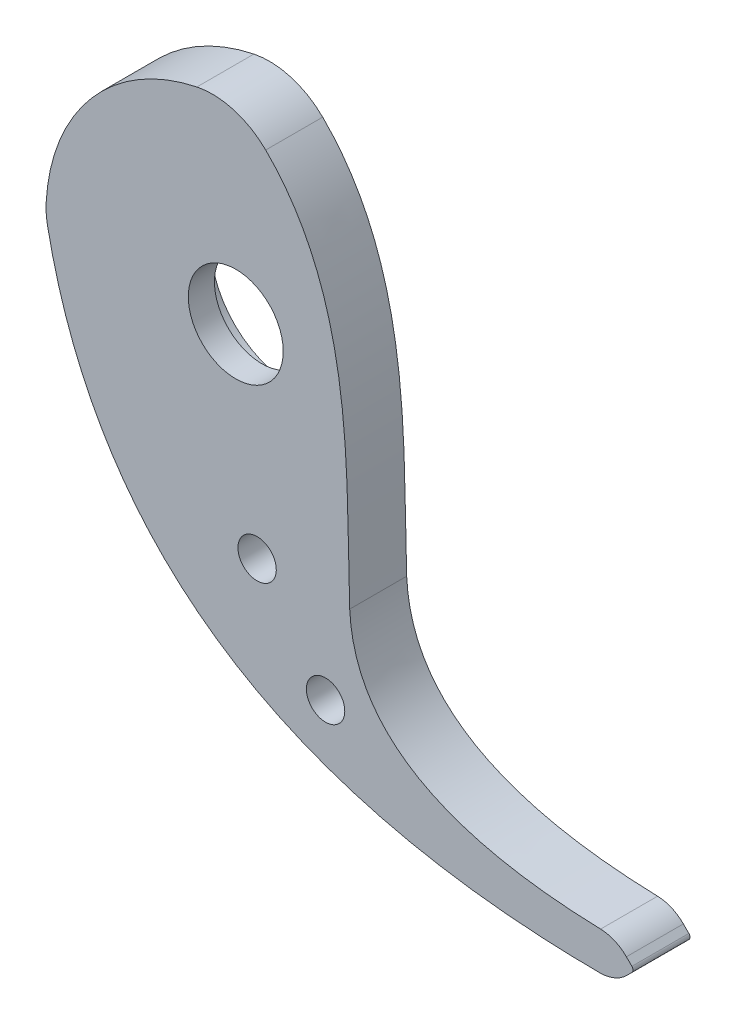
from build123d import *

# Parameters (mm, degrees)
CROQUIS1_R              = 10
SALIENTE_EXTRUIR1_DEPTH = 100
CORTAR_EXTRUIR4_DEPTH   = 15
CROQUIS3_W              = 244.799963401
CROQUIS3_H              = 159.784694376
CORTAR_EXTRUIR5_DEPTH   = 35
CROQUIS4_W              = 177.681228393
CROQUIS4_H              = 202.290816813
CORTAR_EXTRUIR6_DEPTH   = 50
CAVIDAD1_START          = 90.384084462
CAVIDAD1_OUTLINE_R      = 5.05
CAVIDAD1_DEPTH          = 9.615915538
CAVIDAD1_START_2        = 85
CAVIDAD1_2_OUTLINE_R    = 3.03
CAVIDAD1_2_DEPTH        = 5.384084462
CROQUIS5_R              = 21
CORTAR_EXTRUIR7_DEPTH   = 8
CROQUIS6_R              = 12.5
CORTAR_EXTRUIR8_DEPTH   = 8
SALIENTE_EXTRUIR2_START = 8
CROQUIS7_R              = 21
CROQUIS7_R_2            = 12.5
SALIENTE_EXTRUIR2_DEPTH = 8
CROQUIS8_R              = 21
CORTAR_EXTRUIR9_DEPTH   = 8
CAVIDAD2_START          = 85
CAVIDAD2_OUTLINE_R      = 21.63
CAVIDAD2_DEPTH          = 8.12


# Read off the part's stored shape, not the designer's step: Cavidad1, Cavidad2
with BuildPart() as part:
    # Croquis1 → Saliente-Extruir1 (new body)
    with BuildSketch(Plane.XY):
        with BuildLine():
            Line((102.84709295, -92.84709295), (104.292893219, -94.292893219))
            ThreePointArc((104.292893219, -94.292893219), (104.585786438, -95), (104.292893219, -95.707106781))
            Line((104.292893219, -95.707106781), (102.924090823, -97.075909177))
            ThreePointArc((102.924090823, -97.075909177), (99.655924863, -99.253513567), (95.801242309, -100.004707302))
            add(Edge.make_bspline(
                [(-49.58600728, -2.205776949), (-47.044709507, -15.23286343), (-27.045253615, -73.563310407), (28.636670051, -99.656919769), (95.801242309, -100.004707302)],
                knots=[0.011039812, 0.011039812, 0.011039812, 0.011039812, 0.207725041, 0.983937689, 0.983937689, 0.983937689, 0.983937689], degree=3))
            ThreePointArc((-49.58600728, -2.205776949), (-49.90808847, 0.239585929), (-49.92672205, 2.705998037))
            ThreePointArc((-49.92672205, 2.705998037), (-37.935964584, 32.570885635), (-10.229250857, 48.942439936))
            ThreePointArc((-10.229250857, 48.942439936), (-0.503550938, 48.555514737), (7.88775097, 43.623476385))
            add(Edge.make_bspline(
                [(30, -50), (29.065577858, -23.91659264), (31.451883129, 15.353668912), (10.5535399, 41.001196903), (7.88775097, 43.623476385)],
                knots=[0, 0, 0, 0, 0.805376889, 0.908560603, 0.908560603, 0.908560603, 0.908560603], degree=3))
            add(Edge.make_bspline(
                [(96.061432126, -89.922234449), (74.639632489, -89.310592156), (42.207594165, -82.045244121), (30.598677739, -62.69576919), (30, -50)],
                knots=[0.027764728, 0.027764728, 0.027764728, 0.027764728, 0.487449894, 0.947135059, 0.947135059, 0.947135059, 0.947135059], degree=3))
            ThreePointArc((96.061432126, -89.922234449), (99.734323975, -90.734922209), (102.84709295, -92.84709295))
        make_face()
        Circle(CROQUIS1_R, mode=Mode.SUBTRACT)
    extrude(amount=SALIENTE_EXTRUIR1_DEPTH)

    # Croquis2 → Cortar-Extruir4 (cut)
    with BuildSketch(Plane(origin=(0, 0, 0), x_dir=(-1, 0, 0), z_dir=(0, 0, -1))):
        with BuildLine():
            ThreePointArc((1.102623365, 39.984799883), (1.653330869, 39.965816607), (2.203724614, 39.939248839))
            ThreePointArc((2.203724614, 39.939248839), (3.208029629, 37.678468026), (3.853201686, 35.290265468))
            ThreePointArc((3.853201686, 35.290265468), (4.391380959, 35.227344113), (4.928537187, 35.156215968))
            ThreePointArc((4.928537187, 35.156215968), (6.140272041, 37.312939662), (7.668866774, 39.257973488))
            ThreePointArc((7.668866774, 39.257973488), (8.208938801, 39.148605643), (8.747452981, 39.031808392))
            ThreePointArc((8.747452981, 39.031808392), (9.365948293, 36.63655851), (9.609235823, 34.174736091))
            ThreePointArc((9.609235823, 34.174736091), (10.129718517, 34.024091505), (10.647841327, 33.865520446))
            ThreePointArc((10.647841327, 33.865520446), (12.198034749, 35.793384238), (14.025923488, 37.460291914))
            ThreePointArc((14.025923488, 37.460291914), (14.540628281, 37.263522769), (15.052573634, 37.05968196))
            ThreePointArc((15.052573634, 37.05968196), (15.268388303, 34.595299183), (15.103155055, 32.127009001))
            ThreePointArc((15.103155055, 32.127009001), (15.591743761, 31.892750375), (16.076700112, 31.651061807))
            ThreePointArc((16.076700112, 31.651061807), (17.923066867, 33.297478598), (20.000389573, 34.640791229))
            ThreePointArc((20.000389573, 34.640791229), (20.475687326, 34.361988134), (20.947099317, 34.076664012))
            ThreePointArc((20.947099317, 34.076664012), (20.754346482, 31.610370276), (20.18509959, 29.202940855))
            ThreePointArc((20.18509959, 29.202940855), (20.628466879, 28.891458153), (21.067028427, 28.57324471))
            ThreePointArc((21.067028427, 28.57324471), (23.159204443, 29.893304542), (25.429297167, 30.87638006))
            ThreePointArc((25.429297167, 30.87638006), (25.852222997, 30.523148037), (26.270242736, 30.164123501))
            ThreePointArc((26.270242736, 30.164123501), (25.674180192, 27.763192871), (24.716447225, 25.482292608))
            ThreePointArc((24.716447225, 25.482292608), (25.102499195, 25.102082267), (25.482703124, 24.716023982))
            ThreePointArc((25.482703124, 24.716023982), (27.763619294, 25.673719065), (30.164559823, 26.269741732))
            ThreePointArc((30.164559823, 26.269741732), (30.523577417, 25.85171603), (30.876802415, 25.428784332))
            ThreePointArc((30.876802415, 25.428784332), (29.893689193, 23.158707937), (28.573594612, 21.066553846))
            ThreePointArc((28.573594612, 21.066553846), (28.891800771, 20.627987013), (29.203276108, 20.18461455))
            ThreePointArc((29.203276108, 20.18461455), (31.610714984, 20.753821458), (34.077011921, 20.94653333))
            ThreePointArc((34.077011921, 20.94653333), (34.362328213, 20.4751166), (34.641123413, 19.999814215))
            ThreePointArc((34.641123413, 19.999814215), (33.297776281, 17.922513822), (31.651328823, 16.076174412))
            ThreePointArc((31.651328823, 16.076174412), (31.893009337, 15.591214047), (32.127259848, 15.102621451))
            ThreePointArc((32.127259848, 15.102621451), (34.595552773, 15.267813702), (37.059931966, 15.051958102))
            ThreePointArc((37.059931966, 15.051958102), (37.263764272, 14.540009363), (37.460524868, 14.025301302))
            ThreePointArc((37.460524868, 14.025301302), (35.793586832, 12.197440249), (33.865697293, 10.647278847))
            ThreePointArc((33.865697293, 10.647278847), (34.024259747, 10.129153404), (34.174895688, 9.608668207))
            ThreePointArc((34.174895688, 9.608668207), (36.636714066, 9.365339789), (39.031953674, 8.746804694))
            ThreePointArc((39.031953674, 8.746804694), (39.148741981, 8.208288574), (39.258100856, 7.668214731))
            ThreePointArc((39.258100856, 7.668214731), (37.313041641, 6.139652303), (35.156297822, 4.927953271))
            ThreePointArc((35.156297822, 4.927953271), (35.227417046, 4.390795861), (35.290329461, 3.852615543))
            ThreePointArc((35.290329461, 3.852615543), (37.678521304, 3.20740382), (39.939285436, 2.203061256))
            ThreePointArc((39.939285436, 2.203061256), (39.965844062, 1.65266707), (39.984818192, 1.101959251))
            ThreePointArc((39.984818192, 1.101959251), (37.814693942, -0.085609353), (35.487926192, -0.925794025))
            ThreePointArc((35.487926192, -0.925794025), (35.469662238, -1.467331147), (35.443135042, -2.00852643))
            ThreePointArc((35.443135042, -2.00852643), (37.692556701, -3.038021764), (39.757177604, -4.400775951))
            ThreePointArc((39.757177604, -4.400775951), (39.692782099, -4.948034883), (39.620853919, -5.494354805))
            ThreePointArc((39.620853919, -5.494354805), (37.284859968, -6.308535809), (34.851536446, -6.754288072))
            ThreePointArc((34.851536446, -6.754288072), (34.744387508, -7.285433186), (34.629144292, -7.814881038))
            ThreePointArc((34.629144292, -7.814881038), (36.678437409, -9.200578033), (38.490597607, -10.884571461))
            ThreePointArc((38.490597607, -10.884571461), (38.337004513, -11.413767343), (38.176136036, -11.940797184))
            ThreePointArc((38.176136036, -11.940797184), (35.737992209, -12.359381853), (33.264487636, -12.398542748))
            ThreePointArc((33.264487636, -12.398542748), (33.071376458, -12.904807599), (32.870560757, -13.408066063))
            ThreePointArc((32.870560757, -13.408066063), (34.663825958, -15.112166519), (36.174094444, -17.071464236))
            ThreePointArc((36.174094444, -17.071464236), (35.935493381, -17.568161984), (35.690072679, -18.061525743))
            ThreePointArc((35.690072679, -18.061525743), (33.216285184, -18.073096179), (30.770070318, -17.704597499))
            ThreePointArc((30.770070318, -17.704597499), (30.496264469, -18.172172502), (30.215354012, -18.635513998))
            ThreePointArc((30.215354012, -18.635513998), (31.703675696, -20.611534496), (32.870856284, -22.792691969))
            ThreePointArc((32.870856284, -22.792691969), (32.553755666, -23.243342962), (32.230477177, -23.689582963))
            ThreePointArc((32.230477177, -23.689582963), (29.788524487, -23.293823554), (27.436325694, -22.527716982))
            ThreePointArc((27.436325694, -22.527716982), (27.089293883, -22.94384791), (26.735951175, -23.35463369))
            ThreePointArc((26.735951175, -23.35463369), (27.878731807, -25.548673542), (28.670986852, -27.89219448))
            ThreePointArc((28.670986852, -27.89219448), (28.284036357, -28.284506136), (27.891718275, -28.671450114))
            ThreePointArc((27.891718275, -28.671450114), (25.548210496, -27.879156145), (23.354189625, -26.736339072))
            ThreePointArc((23.354189625, -26.736339072), (22.943397976, -27.089674957), (22.527261285, -27.436699856))
            ThreePointArc((22.527261285, -27.436699856), (23.293328789, -29.788911374), (23.689047639, -32.230870636))
            ThreePointArc((23.689047639, -32.230870636), (23.242802268, -32.554141714), (22.792146008, -32.871234847))
            ThreePointArc((22.792146008, -32.871234847), (20.611007921, -31.704018032), (18.635012143, -30.215663528))
            ThreePointArc((18.635012143, -30.215663528), (18.171665982, -30.496566289), (17.704086432, -30.770364373))
            ThreePointArc((17.704086432, -30.770364373), (18.072544482, -33.216585358), (18.060932958, -35.690372661))
            ThreePointArc((18.060932958, -35.690372661), (17.567565123, -35.935785168), (17.070863412, -36.174377982))
            ThreePointArc((17.070863412, -36.174377982), (15.111590779, -34.664076954), (13.407520108, -32.870783449))
            ThreePointArc((13.407520108, -32.870783449), (12.90425831, -33.071590791), (12.397990251, -33.264693561))
            ThreePointArc((12.397990251, -33.264693561), (12.358788274, -35.738197483), (11.940163108, -38.176334357))
            ThreePointArc((11.940163108, -38.176334357), (11.413130596, -38.337194081), (10.883932163, -38.490778385))
            ThreePointArc((10.883932163, -38.490778385), (9.199968834, -36.678590218), (7.814305875, -34.629274085))
            ThreePointArc((7.814305875, -34.629274085), (7.28485611, -34.744508508), (6.753709216, -34.851648624))
            ThreePointArc((6.753709216, -34.851648624), (6.307916538, -37.284964743), (5.493696735, -39.62094517))
            ThreePointArc((5.493696735, -39.62094517), (4.947375618, -39.692864277), (4.400115616, -39.757250692))
            ThreePointArc((4.400115616, -39.757250692), (3.037395721, -37.692607155), (2.007937749, -35.443168397))
            ThreePointArc((2.007937749, -35.443168397), (1.466742025, -35.469686605), (0.9252046, -35.487941564))
            ThreePointArc((0.9252046, -35.487941564), (0.084981283, -37.814695359), (-1.102623365, -39.984799883))
            ThreePointArc((-1.102623365, -39.984799883), (-1.653330869, -39.965816607), (-2.203724614, -39.939248839))
            ThreePointArc((-2.203724614, -39.939248839), (-3.208029629, -37.678468026), (-3.853201686, -35.290265468))
            ThreePointArc((-3.853201686, -35.290265468), (-4.391380959, -35.227344113), (-4.928537187, -35.156215968))
            ThreePointArc((-4.928537187, -35.156215968), (-6.140272041, -37.312939662), (-7.668866774, -39.257973488))
            ThreePointArc((-7.668866774, -39.257973488), (-8.208938801, -39.148605643), (-8.747452981, -39.031808392))
            ThreePointArc((-8.747452981, -39.031808392), (-9.365948293, -36.63655851), (-9.609235823, -34.174736091))
            ThreePointArc((-9.609235823, -34.174736091), (-10.129718517, -34.024091505), (-10.647841327, -33.865520446))
            ThreePointArc((-10.647841327, -33.865520446), (-12.198034749, -35.793384238), (-14.025923488, -37.460291914))
            ThreePointArc((-14.025923488, -37.460291914), (-14.540628281, -37.263522769), (-15.052573634, -37.05968196))
            ThreePointArc((-15.052573634, -37.05968196), (-15.268388303, -34.595299183), (-15.103155055, -32.127009001))
            ThreePointArc((-15.103155055, -32.127009001), (-15.591743761, -31.892750375), (-16.076700112, -31.651061807))
            ThreePointArc((-16.076700112, -31.651061807), (-17.923066867, -33.297478598), (-20.000389573, -34.640791229))
            ThreePointArc((-20.000389573, -34.640791229), (-20.475687326, -34.361988134), (-20.947099317, -34.076664012))
            ThreePointArc((-20.947099317, -34.076664012), (-20.754346482, -31.610370276), (-20.18509959, -29.202940855))
            ThreePointArc((-20.18509959, -29.202940855), (-20.628466879, -28.891458153), (-21.067028427, -28.57324471))
            ThreePointArc((-21.067028427, -28.57324471), (-23.159204443, -29.893304542), (-25.429297167, -30.87638006))
            ThreePointArc((-25.429297167, -30.87638006), (-25.852222997, -30.523148037), (-26.270242736, -30.164123501))
            ThreePointArc((-26.270242736, -30.164123501), (-25.674180192, -27.763192871), (-24.716447225, -25.482292608))
            ThreePointArc((-24.716447225, -25.482292608), (-25.102499195, -25.102082267), (-25.482703124, -24.716023982))
            ThreePointArc((-25.482703124, -24.716023982), (-27.421409872, -25.555856409), (-29.453588357, -26.133916065))
            add(Edge.make_bspline(
                [(-30, -50), (-29.734872846, -42.599255467), (-29.715262914, -34.495945215), (-29.453588357, -26.133916065)],
                knots=[0, 0, 0, 0, 0.228512653, 0.228512653, 0.228512653, 0.228512653], degree=3))
            add(Edge.make_bspline(
                [(-96.061432126, -89.922234449), (-74.639632489, -89.310592156), (-42.207594165, -82.045244121), (-30.598677739, -62.69576919), (-30, -50)],
                knots=[0.027764728, 0.027764728, 0.027764728, 0.027764728, 0.487449894, 0.947135059, 0.947135059, 0.947135059, 0.947135059], degree=3))
            ThreePointArc((-96.061432126, -89.922234449), (-99.734323975, -90.734922209), (-102.84709295, -92.84709295))
            Line((-102.84709295, -92.84709295), (-104.292893219, -94.292893219))
            ThreePointArc((-104.292893219, -94.292893219), (-104.585786438, -95), (-104.292893219, -95.707106781))
            Line((-104.292893219, -95.707106781), (-102.924090823, -97.075909177))
            ThreePointArc((-102.924090823, -97.075909177), (-99.655924863, -99.253513567), (-95.801242309, -100.004707302))
            add(Edge.make_bspline(
                [(49.58600728, -2.205776949), (47.044709507, -15.23286343), (27.045253615, -73.563310407), (-28.636670051, -99.656919769), (-95.801242309, -100.004707302)],
                knots=[0.011039812, 0.011039812, 0.011039812, 0.011039812, 0.207725041, 0.983937689, 0.983937689, 0.983937689, 0.983937689], degree=3))
            ThreePointArc((49.58600728, -2.205776949), (49.90808847, 0.239585929), (49.92672205, 2.705998037))
            ThreePointArc((49.92672205, 2.705998037), (37.935964584, 32.570885635), (10.229250857, 48.942439936))
            ThreePointArc((10.229250857, 48.942439936), (0.503550938, 48.555514737), (-7.88775097, 43.623476385))
            add(Edge.make_bspline(
                [(-15.182020199, 34.727214957), (-15.121605489, 34.818294405), (-12.99668952, 38.002837294), (-10.5535399, 41.001196903), (-7.88775097, 43.623476385)],
                knots=[0.802344073, 0.802344073, 0.802344073, 0.802344073, 0.805376889, 0.908560603, 0.908560603, 0.908560603, 0.908560603], degree=3))
            ThreePointArc((-15.182020199, 34.727214957), (-14.257602386, 33.834526615), (-13.407520108, 32.870783449))
            ThreePointArc((-13.407520108, 32.870783449), (-12.90425831, 33.071590791), (-12.397990251, 33.264693561))
            ThreePointArc((-12.397990251, 33.264693561), (-12.358788274, 35.738197483), (-11.940163108, 38.176334357))
            ThreePointArc((-11.940163108, 38.176334357), (-11.413130596, 38.337194081), (-10.883932163, 38.490778385))
            ThreePointArc((-10.883932163, 38.490778385), (-9.199968834, 36.678590218), (-7.814305875, 34.629274085))
            ThreePointArc((-7.814305875, 34.629274085), (-7.28485611, 34.744508508), (-6.753709216, 34.851648624))
            ThreePointArc((-6.753709216, 34.851648624), (-6.307916538, 37.284964743), (-5.493696735, 39.62094517))
            ThreePointArc((-5.493696735, 39.62094517), (-4.947375618, 39.692864277), (-4.400115616, 39.757250692))
            ThreePointArc((-4.400115616, 39.757250692), (-3.037395721, 37.692607155), (-2.007937749, 35.443168397))
            ThreePointArc((-2.007937749, 35.443168397), (-1.466742025, 35.469686605), (-0.9252046, 35.487941564))
            ThreePointArc((-0.9252046, 35.487941564), (-0.084981283, 37.814695359), (1.102623365, 39.984799883))
        make_face()
    extrude(amount=-CORTAR_EXTRUIR4_DEPTH, mode=Mode.SUBTRACT)

    # Croquis3 → Cortar-Extruir5 (cut)
    with BuildSketch(Plane(origin=(0, 0, 0), x_dir=(-1, 0, 0), z_dir=(0, 0, -1))):
        with Locations((-26.261343778, -29.231181028)):
            Rectangle(CROQUIS3_W, CROQUIS3_H)
    extrude(amount=-CORTAR_EXTRUIR5_DEPTH, mode=Mode.SUBTRACT)

    # Croquis4 → Cortar-Extruir6 (cut)
    with BuildSketch(Plane(origin=(0, 0, 35), x_dir=(-1, 0, 0), z_dir=(0, 0, -1))):
        with Locations((-31.414152083, -26.798932517)):
            Rectangle(CROQUIS4_W, CROQUIS4_H)
    extrude(amount=-CORTAR_EXTRUIR6_DEPTH, mode=Mode.SUBTRACT)

    # Cavidad1 outline → Cavidad1 (cut)
    with BuildSketch(Plane.XY.offset(CAVIDAD1_START)):
        with Locations((5.62196341, -50.701498074)):
            Circle(CAVIDAD1_OUTLINE_R)
        with Locations((23.651318082, -73.91381178)):
            Circle(CAVIDAD1_OUTLINE_R)
    extrude(amount=CAVIDAD1_DEPTH, mode=Mode.SUBTRACT)

    # Cavidad1 2 outline → Cavidad1 2 (cut)
    with BuildSketch(Plane.XY.offset(CAVIDAD1_START_2)):
        with Locations((5.62196341, -50.701498074)):
            Circle(CAVIDAD1_2_OUTLINE_R)
        with Locations((23.651318082, -73.91381178)):
            Circle(CAVIDAD1_2_OUTLINE_R)
    extrude(amount=CAVIDAD1_2_DEPTH, mode=Mode.SUBTRACT)

    # Croquis5 → Cortar-Extruir7 (cut)
    with BuildSketch(Plane.XY.offset(100)):
        Circle(CROQUIS5_R)
    extrude(amount=-CORTAR_EXTRUIR7_DEPTH, mode=Mode.SUBTRACT)

    # Croquis6 → Cortar-Extruir8 (cut)
    with BuildSketch(Plane.XY.offset(92)):
        Circle(CROQUIS6_R)
    extrude(amount=-CORTAR_EXTRUIR8_DEPTH, mode=Mode.SUBTRACT)

    # Croquis7 → Saliente-Extruir2 (add)
    with BuildSketch(Plane.XY.offset(92).offset(SALIENTE_EXTRUIR2_START)):
        Circle(CROQUIS7_R)
        Circle(CROQUIS7_R_2, mode=Mode.SUBTRACT)
    extrude(amount=-SALIENTE_EXTRUIR2_DEPTH)

    # Croquis8 → Cortar-Extruir9 (cut)
    with BuildSketch(Plane(origin=(0, 0, 85), x_dir=(-1, 0, 0), z_dir=(0, 0, -1))):
        Circle(CROQUIS8_R)
    extrude(amount=-CORTAR_EXTRUIR9_DEPTH, mode=Mode.SUBTRACT)

    # Cavidad2 outline → Cavidad2 (cut)
    with BuildSketch(Plane.XY.offset(CAVIDAD2_START)):
        Circle(CAVIDAD2_OUTLINE_R)
    extrude(amount=CAVIDAD2_DEPTH, mode=Mode.SUBTRACT)


solid = part.part
